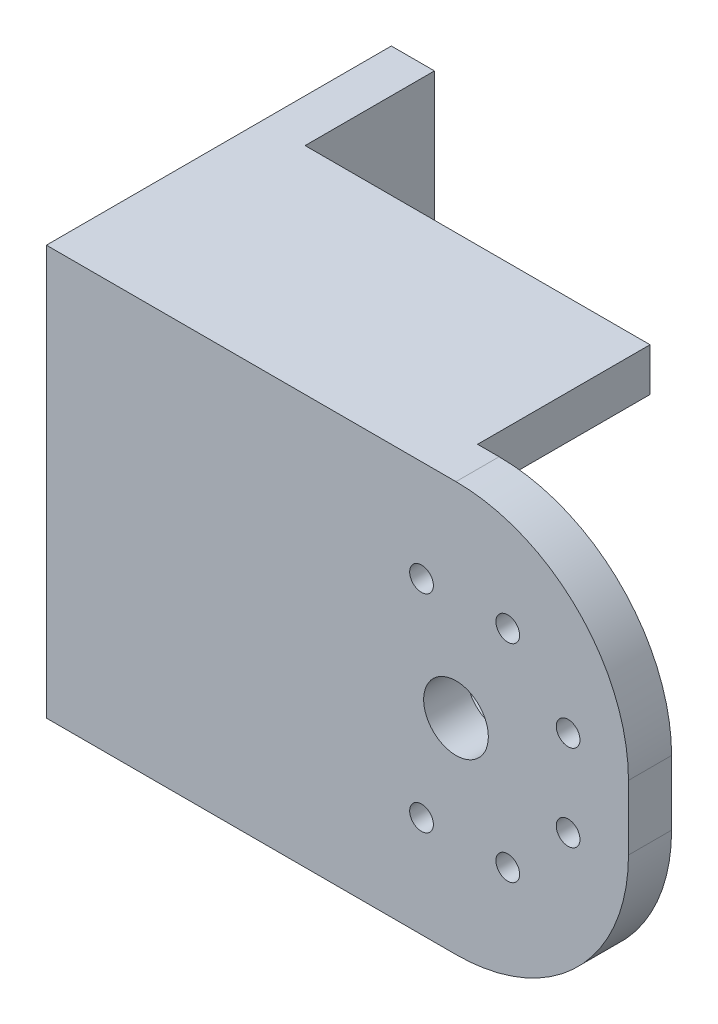
from build123d import *

# Parameters (mm, degrees)
SKETCH3_R           = 7.5
SKETCH3_R_2         = 2.75
BOSS_EXTRUDE1_DEPTH = 10
SKETCH4_W           = 10
SKETCH4_H           = 95
BOSS_EXTRUDE2_DEPTH = 70
SKETCH5_W           = 80
SKETCH5_H           = 10
BOSS_EXTRUDE3_DEPTH = 40
SKETCH6_W           = 32
SKETCH6_H           = 36
CUT_EXTRUDE1_DEPTH  = 43.8
SKETCH8_R           = 7.5
SKETCH8_R_2         = 2.75
CUT_EXTRUDE2_DEPTH  = 43.8
FILLET3_R           = 3


with BuildPart() as part:
    # Sketch3 → Boss-Extrude1 (new body)
    with BuildSketch(Plane.XY):
        with BuildLine():
            Line((68.617133813, 80.05993294), (163.617133813, 80.05993294))
            ThreePointArc((163.617133813, 80.05993294), (191.90140506, 68.344204188), (203.617133813, 40.05993294))
            Line((203.617133813, 40.05993294), (203.617133813, 25.05993294))
            ThreePointArc((203.617133813, 25.05993294), (191.90140506, -3.224338307), (163.617133813, -14.94006706))
            Line((163.617133813, -14.94006706), (68.617133813, -14.94006706))
            Line((68.617133813, -14.94006706), (68.617133813, 80.05993294))
        make_face()
        with Locations((163.617133813, 32.55993294)):
            Circle(SKETCH3_R, mode=Mode.SUBTRACT)
        with Locations((189.617133813, 42.55993294)):
            Circle(SKETCH3_R_2, mode=Mode.SUBTRACT)
        with Locations((155.617133813, 56.55993294)):
            Circle(SKETCH3_R_2, mode=Mode.SUBTRACT)
        with Locations((175.617133813, 56.55993294)):
            Circle(SKETCH3_R_2, mode=Mode.SUBTRACT)
        with Locations((155.617133813, 8.55993294)):
            Circle(SKETCH3_R_2, mode=Mode.SUBTRACT)
        with Locations((175.617133813, 8.55993294)):
            Circle(SKETCH3_R_2, mode=Mode.SUBTRACT)
        with Locations((189.617133813, 22.55993294)):
            Circle(SKETCH3_R_2, mode=Mode.SUBTRACT)
    extrude(amount=BOSS_EXTRUDE1_DEPTH)

    # Sketch4 → Boss-Extrude2 (add)
    with BuildSketch(Plane(origin=(0, 0, 0), x_dir=(-1, 0, 0), z_dir=(0, 0, -1))):
        with Locations((-73.617133813, 32.55993294)):
            Rectangle(SKETCH4_W, SKETCH4_H)
    extrude(amount=BOSS_EXTRUDE2_DEPTH)

    # Sketch5 → Boss-Extrude3 (add)
    with BuildSketch(Plane(origin=(0, 0, 0), x_dir=(-1, 0, 0), z_dir=(0, 0, -1))):
        with Locations((-118.617133813, 75.05993294)):
            Rectangle(SKETCH5_W, SKETCH5_H)
        with Locations((-118.617133813, -9.94006706)):
            Rectangle(SKETCH5_W, SKETCH5_H)
    extrude(amount=BOSS_EXTRUDE3_DEPTH)

    # Sketch6 → Cut-Extrude1 (cut)
    with BuildSketch(Plane.XZ.offset(14.94006706)):
        with Locations((104.617133813, -18)):
            Rectangle(SKETCH6_W, SKETCH6_H)
    extrude(amount=-CUT_EXTRUDE1_DEPTH, mode=Mode.SUBTRACT)

    # Sketch8 → Cut-Extrude2 (cut)
    with BuildSketch(Plane.ZY.offset(-68.617133813)):
        with Locations((-40, 32.55993294)):
            Circle(SKETCH8_R)
        with Locations((-56.167891819, 25.862972874)):
            Circle(SKETCH8_R_2)
        with Locations((-56.167891819, 39.256893006)):
            Circle(SKETCH8_R_2)
        with Locations((-46.696960066, 48.727824759)):
            Circle(SKETCH8_R_2)
        with Locations((-33.303039934, 48.727824759)):
            Circle(SKETCH8_R_2)
        with Locations((-23.832108181, 39.256893006)):
            Circle(SKETCH8_R_2)
        with Locations((-23.832108181, 25.862972874)):
            Circle(SKETCH8_R_2)
        with Locations((-33.303039934, 16.392041121)):
            Circle(SKETCH8_R_2)
        with Locations((-46.696960066, 16.392041121)):
            Circle(SKETCH8_R_2)
    extrude(amount=-CUT_EXTRUDE2_DEPTH, mode=Mode.SUBTRACT)

    # Fillet3
    fillet3_edges = [part.edges().sort_by_distance(p)[0] for p in [
        (120.617133813, -4.94006706, -18),
        (120.617133813, -14.94006706, -18),
        (88.617133813, -14.94006706, -18),
        (88.617133813, -4.94006706, -18),
        (104.617133813, -14.94006706, 0),
    ]]
    fillet(fillet3_edges, radius=FILLET3_R)


solid = part.part
